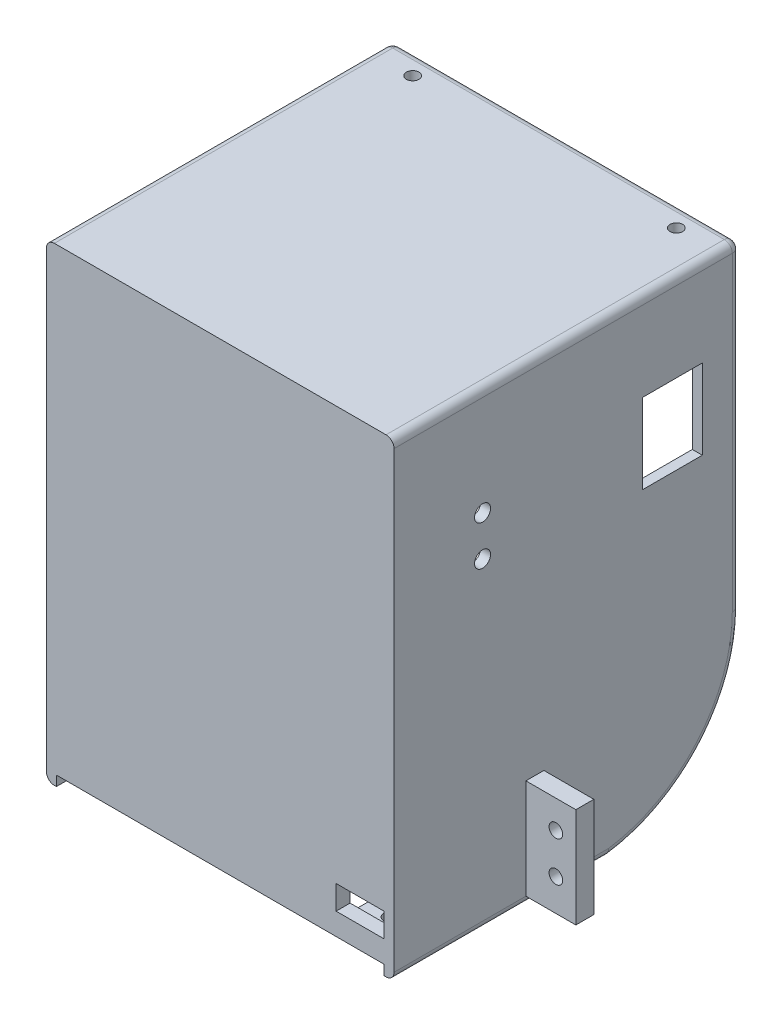
from build123d import *
from build123d.topology import SkipClean

# Parameters (mm, degrees)
BOSS_EXTRUDE1_DEPTH     = 50
SKETCH3_W               = 92
SKETCH3_H               = 120
BOSS_EXTRUDE2_DEPTH     = 5
SKETCH4_W               = 8.115199035
SKETCH4_H               = 120
BOSS_EXTRUDE3_DEPTH     = 12
BOSS_EXTRUDE4_DEPTH     = 60
SKETCH5_W               = 10
SKETCH5_H               = 2
BOSS_EXTRUDE5_DEPTH     = 20
BOSS_EXTRUDE6_START     = 50
SKETCH5_2_W             = 10
SKETCH5_2_H             = 2
BOSS_EXTRUDE6_DEPTH     = 20
SKETCH6_W               = 92
SKETCH6_H               = 120
BOSS_EXTRUDE7_DEPTH     = 5
SKETCH7_W               = 7
SKETCH7_H               = 10
SKETCH7_R               = 1.6
BOSS_EXTRUDE8_DEPTH     = 3
CUT_EXTRUDE2_DEPTH      = 164.816971038
CUT_EXTRUDE4_DEPTH      = 165.373051319
CUT_EXTRUDE4_DEPTH_BACK = 165.373051319
SKETCH12_W              = 112.5
SKETCH12_H              = 2.5
SKETCH14_W              = 106
SKETCH14_H              = 1.5
CUT_EXTRUDE5_DEPTH      = 162.085381087
SKETCH15_R              = 1.6
BOSS_EXTRUDE10_DEPTH    = 2
SKETCH16_W              = 87
SKETCH16_H              = 3.364665628
CUT_EXTRUDE6_DEPTH      = 162.085381087
SKETCH17_W              = 10
SKETCH17_H              = 2
CUT_EXTRUDE7_DEPTH      = 70
SKETCH19_W              = 7
SKETCH19_H              = 10
SKETCH19_R              = 1.6
BOSS_EXTRUDE11_DEPTH    = 3.5
SKETCH21_W              = 7
SKETCH21_H              = 10
SKETCH21_R              = 1.6
BOSS_EXTRUDE13_DEPTH    = 3.5
SKETCH22_W              = 9.5
SKETCH22_H              = 117.5
CUT_EXTRUDE8_DEPTH      = 186.007067988
CUT_EXTRUDE9_DEPTH      = 156.903445849
SKETCH26_W              = 12
SKETCH26_H              = 12
CUT_EXTRUDE10_DEPTH     = 8.115199035
SKETCH27_R              = 1.575
CUT_EXTRUDE11_DEPTH     = 6
SKETCH28_W              = 82
SKETCH28_H              = 11.615199035
CUT_EXTRUDE12_DEPTH     = 2.5
SKETCH30_R              = 1.575
CUT_EXTRUDE13_DEPTH     = 2.5
SKETCH31_W              = 12
SKETCH31_H              = 6
CUT_EXTRUDE14_DEPTH     = 3.5
FILLET1_R               = 2
FILLET2_R               = 2
SKETCH32_W              = 15
SKETCH32_H              = 20
CUT_EXTRUDE15_DEPTH     = 2.5
SKETCH33_R              = 2
CUT_EXTRUDE16_DEPTH     = 2.5
SKETCH37_W              = 4.5
SKETCH37_H              = 25
BOSS_EXTRUDE17_DEPTH    = 12.5
BOSS_EXTRUDE18_START    = -87
SKETCH37_2_W            = 4.5
SKETCH37_2_H            = 25
BOSS_EXTRUDE18_DEPTH    = 12.5
SKETCH39_R              = 1.7
CUT_EXTRUDE17_DEPTH     = 4.5
SKETCH40_R              = 1.7
CUT_EXTRUDE18_DEPTH     = 4.5


with BuildPart() as part:
    # Sketch2 → Boss-Extrude1 (new body)
    with BuildSketch(Plane.XY):
        Polygon((0, 0), (0, 115), (82, 115), (82, 0), (87, 0), (87, 120), (-5, 120), (-5, 0), align=None)
    extrude(amount=BOSS_EXTRUDE1_DEPTH)

    # Sketch3 → Boss-Extrude2 (add)
    with BuildSketch(Plane.XY.offset(50)):
        with Locations((41, 60)):
            Rectangle(SKETCH3_W, SKETCH3_H)
    extrude(amount=BOSS_EXTRUDE2_DEPTH)

    # Sketch4 → Boss-Extrude3 (add)
    with BuildSketch(Plane.ZY.offset(-82)):
        with Locations((45.942400483, 60)):
            Rectangle(SKETCH4_W, SKETCH4_H)
    extrude(amount=BOSS_EXTRUDE3_DEPTH)

    # Sketch2<2> → Boss-Extrude4 (add)
    with BuildSketch(Plane.XY):
        Polygon((0, 0), (0, 115), (82, 115), (82, 0), (87, 0), (87, 120), (-5, 120), (-5, 0), align=None)
    extrude(amount=-BOSS_EXTRUDE4_DEPTH)

    # Sketch5 → Boss-Extrude5 (add)
    with BuildSketch(Plane.XZ.offset(-115)):
        with Locations((5, 7.889828052)):
            Rectangle(SKETCH5_W, SKETCH5_H)
        with Locations((5, 2.689828052)):
            Rectangle(SKETCH5_W, SKETCH5_H)
        with Locations((77, 2.689828052)):
            Rectangle(SKETCH5_W, SKETCH5_H)
        with Locations((77, 7.889828052)):
            Rectangle(SKETCH5_W, SKETCH5_H)
    extrude(amount=BOSS_EXTRUDE5_DEPTH)

    # Sketch5<2> → Boss-Extrude6 (add)
    with BuildSketch(Plane.XZ.offset(-115).offset(BOSS_EXTRUDE6_START)):
        with Locations((5, 7.889828052)):
            Rectangle(SKETCH5_2_W, SKETCH5_2_H)
        with Locations((5, 2.689828052)):
            Rectangle(SKETCH5_2_W, SKETCH5_2_H)
        with Locations((77, 2.689828052)):
            Rectangle(SKETCH5_2_W, SKETCH5_2_H)
        with Locations((77, 7.889828052)):
            Rectangle(SKETCH5_2_W, SKETCH5_2_H)
    extrude(amount=BOSS_EXTRUDE6_DEPTH)

    # Sketch6 → Boss-Extrude7 (add)
    with BuildSketch(Plane(origin=(0, 0, -60), x_dir=(-1, 0, 0), z_dir=(0, 0, -1))):
        with Locations((-41, 60)):
            Rectangle(SKETCH6_W, SKETCH6_H)
    extrude(amount=-BOSS_EXTRUDE7_DEPTH)

    # Sketch7 → Boss-Extrude8 (add)
    # profile 1 of 4: a face of its own
    with BuildSketch(Plane.XY.offset(55)):
        with Locations((90.5, 115)):
            Rectangle(SKETCH7_W, SKETCH7_H)
        with Locations((90.472155735, 113.006992181)):
            Circle(SKETCH7_R, mode=Mode.SUBTRACT)
    # profile 2 of 4: a face of its own
    with BuildSketch(Plane.XY.offset(55)):
        with Locations((-8.5, 115)):
            Rectangle(SKETCH7_W, SKETCH7_H)
        with Locations(Location((-8.472155735, 113.006992181, 0), (0, 0, 180))):
            Circle(SKETCH7_R, mode=Mode.SUBTRACT)
    # profile 3 of 4: a face of its own
    with BuildSketch(Plane.XY.offset(55)):
        with Locations((-8.5, 5)):
            Rectangle(SKETCH7_W, SKETCH7_H)
        with Locations((-8.472155735, 6.993007819)):
            Circle(SKETCH7_R, mode=Mode.SUBTRACT)
    # profile 4 of 4: a face of its own
    with BuildSketch(Plane.XY.offset(55)):
        with Locations((90.5, 5)):
            Rectangle(SKETCH7_W, SKETCH7_H)
        with Locations(Location((90.472155735, 6.993007819, 0), (0, 0, 180))):
            Circle(SKETCH7_R, mode=Mode.SUBTRACT)
    extrude(amount=-BOSS_EXTRUDE8_DEPTH)

    # Sketch11 → Cut-Extrude2 (cut, through all)
    with BuildSketch(Plane.XZ):
        Polygon((-5, 52), (-2.5, 52), (-2.5, -57.5), (84.5, -57.5), (84.5, 52), (87, 52), (87, -60), (-5, -60), align=None)
    extrude(amount=-CUT_EXTRUDE2_DEPTH, mode=Mode.SUBTRACT)

    # Sketch12 → Cut-Extrude4 (cut, two sides: drawn at the far end of the back side and taken through both)
    with BuildSketch(Plane.ZY.offset(2.5).offset(-CUT_EXTRUDE4_DEPTH_BACK)):
        with Locations((-1.25, 118.75)):
            Rectangle(SKETCH12_W, SKETCH12_H)
    extrude(amount=CUT_EXTRUDE4_DEPTH + CUT_EXTRUDE4_DEPTH_BACK, mode=Mode.SUBTRACT)

    # Sketch14 → Cut-Extrude5 (cut, through all)
    with BuildSketch(Plane.XZ):
        with Locations((41, 54.25)):
            Rectangle(SKETCH14_W, SKETCH14_H)
    extrude(amount=-CUT_EXTRUDE5_DEPTH, mode=Mode.SUBTRACT)

    # Sketch15 → Boss-Extrude10 (add)
    # profile 1 of 2: a face of its own
    with SkipClean():  # the faces are left unmerged after this step: merging them gives an invalid solid
        with BuildSketch(Plane(origin=(0, 0, 52), x_dir=(-1, 0, 0), z_dir=(0, 0, -1))):
            Polygon((-84.5, 117.5), (-94, 117.5), (-94, 110), (-87, 110), (-87, 10), (-94, 10), (-94, 0), (-84.5, 0), align=None)
            with Locations((-90.472155735, 113.006992181)):
                Circle(SKETCH15_R, mode=Mode.SUBTRACT)
            with Locations((-90.472155735, 6.993007819)):
                Circle(SKETCH15_R, mode=Mode.SUBTRACT)
        # profile 2 of 2: a face of its own
        with BuildSketch(Plane(origin=(0, 0, 52), x_dir=(-1, 0, 0), z_dir=(0, 0, -1))):
            Polygon((2.5, 0), (2.5, 117.5), (12, 117.5), (12, 110), (5, 110), (5, 10), (12, 10), (12, 0), align=None)
            with Locations(Location((8.472155735, 113.006992181, 0), (0, 0, 180))):
                Circle(SKETCH15_R, mode=Mode.SUBTRACT)
            with Locations(Location((8.472155735, 6.993007819, 0), (0, 0, 180))):
                Circle(SKETCH15_R, mode=Mode.SUBTRACT)
        extrude(amount=BOSS_EXTRUDE10_DEPTH)

    # Sketch16 → Cut-Extrude6 (cut, through all)
    with SkipClean():  # the faces are left unmerged after this step: merging them gives an invalid solid
        with BuildSketch(Plane.XZ):
            with Locations((41, -55.817667186)):
                Rectangle(SKETCH16_W, SKETCH16_H)
        extrude(amount=-CUT_EXTRUDE6_DEPTH, mode=Mode.SUBTRACT)

    # Sketch17 → Cut-Extrude7 (cut)
    with SkipClean():  # the faces are left unmerged after this step: merging them gives an invalid solid
        with BuildSketch(Plane.XZ.offset(-45)):
            with Locations((5, 2.689828052)):
                Rectangle(SKETCH17_W, SKETCH17_H)
            with Locations((77, 2.689828052)):
                Rectangle(SKETCH17_W, SKETCH17_H)
        extrude(amount=-CUT_EXTRUDE7_DEPTH, mode=Mode.SUBTRACT)

    # Sketch19 → Boss-Extrude11 (add)
    # profile 1 of 4: a face of its own
    with SkipClean():  # the faces are left unmerged after this step: merging them gives an invalid solid
        with BuildSketch(Plane.XZ):
            with Locations((88, -49.135334372)):
                Rectangle(SKETCH19_W, SKETCH19_H)
            with Locations((87.901562489, -49.234834013)):
                Circle(SKETCH19_R, mode=Mode.SUBTRACT)
        # profile 2 of 4: a face of its own
        with BuildSketch(Plane.XZ):
            with Locations((-6, -49.135334372)):
                Rectangle(SKETCH19_W, SKETCH19_H)
            with Locations(Location((-5.901562489, -49.234834013, 0), (0, 0, 180))):
                Circle(SKETCH19_R, mode=Mode.SUBTRACT)
        # profile 3 of 4: a face of its own
        with BuildSketch(Plane.XZ):
            with Locations((-6, 34.080676656)):
                Rectangle(SKETCH19_W, SKETCH19_H)
            with Locations((-5.901562489, 34.180176298)):
                Circle(SKETCH19_R, mode=Mode.SUBTRACT)
        # profile 4 of 4: a face of its own
        with BuildSketch(Plane.XZ):
            with Locations((88, 34.080676656)):
                Rectangle(SKETCH19_W, SKETCH19_H)
            with Locations(Location((87.901562489, 34.180176298, 0), (0, 0, 180))):
                Circle(SKETCH19_R, mode=Mode.SUBTRACT)
        extrude(amount=-BOSS_EXTRUDE11_DEPTH)

    # Sketch21 → Boss-Extrude13 (add)
    # profile 1 of 4: a face of its own
    with SkipClean():  # the faces are left unmerged after this step: merging them gives an invalid solid
        with BuildSketch(Plane(origin=(0, 0, -54.135334372), x_dir=(-1, 0, 0), z_dir=(0, 0, -1))):
            with Locations((-88, 112.5)):
                Rectangle(SKETCH21_W, SKETCH21_H)
            with Locations((-87.460864154, 112.996655596)):
                Circle(SKETCH21_R, mode=Mode.SUBTRACT)
        # profile 2 of 4: a face of its own
        with BuildSketch(Plane(origin=(0, 0, -54.135334372), x_dir=(-1, 0, 0), z_dir=(0, 0, -1))):
            with Locations((6, 112.5)):
                Rectangle(SKETCH21_W, SKETCH21_H)
            with Locations(Location((5.460864154, 112.996655596, 0), (0, 0, 180))):
                Circle(SKETCH21_R, mode=Mode.SUBTRACT)
        # profile 3 of 4: a face of its own
        with BuildSketch(Plane(origin=(0, 0, -54.135334372), x_dir=(-1, 0, 0), z_dir=(0, 0, -1))):
            with Locations((6, 17.859776919)):
                Rectangle(SKETCH21_W, SKETCH21_H)
            with Locations((5.460864154, 17.363121322)):
                Circle(SKETCH21_R, mode=Mode.SUBTRACT)
        # profile 4 of 4: a face of its own
        with BuildSketch(Plane(origin=(0, 0, -54.135334372), x_dir=(-1, 0, 0), z_dir=(0, 0, -1))):
            with Locations((-88, 17.859776919)):
                Rectangle(SKETCH21_W, SKETCH21_H)
            with Locations(Location((-87.460864154, 17.363121322, 0), (0, 0, 180))):
                Circle(SKETCH21_R, mode=Mode.SUBTRACT)
        extrude(amount=-BOSS_EXTRUDE13_DEPTH)

    # Sketch22 → Cut-Extrude8 (cut, through all)
    with BuildSketch(Plane(origin=(0, 0, -54.135334372), x_dir=(-1, 0, 0), z_dir=(0, 0, -1))):
        with Locations((7.25, 58.75)):
            Rectangle(SKETCH22_W, SKETCH22_H)
        with Locations((-89.25, 58.75)):
            Rectangle(SKETCH22_W, SKETCH22_H)
    extrude(amount=-CUT_EXTRUDE8_DEPTH, mode=Mode.SUBTRACT)

    # Sketch24 → Cut-Extrude9 (cut, through all)
    with BuildSketch(Plane.ZY.offset(2.5)):
        with BuildLine():
            Line((-33.153862192, 117.5), (-33.153862192, 37.737088179))
            ThreePointArc((-33.153862192, 37.737088179), (-23.795591024, 12.725573197), (-0.317667186, 0))
            Line((-0.317667186, 0), (-54.135334372, 0))
            Line((-54.135334372, 0), (-54.135334372, 117.5))
            Line((-54.135334372, 117.5), (-33.153862192, 117.5))
        make_face()
    extrude(amount=-CUT_EXTRUDE9_DEPTH, mode=Mode.SUBTRACT)

    # Sketch26 → Cut-Extrude10 (cut)
    with BuildSketch(Plane(origin=(0, 0, 41.884800965), x_dir=(-1, 0, 0), z_dir=(0, 0, -1))):
        with Locations((-76, 12)):
            Rectangle(SKETCH26_W, SKETCH26_H)
    extrude(amount=-CUT_EXTRUDE10_DEPTH, mode=Mode.SUBTRACT)

    # Sketch27 → Cut-Extrude11 (cut)
    with BuildSketch(Plane.XZ):
        with Locations((76, 46.036602525)):
            Circle(SKETCH27_R)
    extrude(amount=-CUT_EXTRUDE11_DEPTH, mode=Mode.SUBTRACT)

    # Sketch28 → Cut-Extrude12 (cut)
    with BuildSketch(Plane.XZ):
        with Locations((41, 47.692400483)):
            Rectangle(SKETCH28_W, SKETCH28_H)
    extrude(amount=-CUT_EXTRUDE12_DEPTH, mode=Mode.SUBTRACT)

    # Sketch30 → Cut-Extrude13 (cut)
    with BuildSketch(Plane(origin=(0, 117.5, 0), x_dir=(1, 0, 0), z_dir=(0, 1, 0))):
        with Locations(Location((74, 27.653862192, 0), (0, 0, 180))):
            Circle(SKETCH30_R)
        with Locations(Location((8, 27.653862192, 0), (0, 0, 270))):
            Circle(SKETCH30_R)
    extrude(amount=-CUT_EXTRUDE13_DEPTH, mode=Mode.SUBTRACT)

    # Sketch31 → Cut-Extrude14 (cut)
    with BuildSketch(Plane(origin=(0, 0, 50), x_dir=(-1, 0, 0), z_dir=(0, 0, -1))):
        with Locations((-76, 11)):
            Rectangle(SKETCH31_W, SKETCH31_H)
    extrude(amount=-CUT_EXTRUDE14_DEPTH, mode=Mode.SUBTRACT)

    # Fillet1
    fillet1_edges = [part.edges().sort_by_distance(p)[0] for p in [
        (-2.5, 117.5, 10.173068904),
    ]]
    fillet(fillet1_edges, radius=FILLET1_R)

    # Fillet2
    # the kernel refuses this fillet: 2 mm, written as the material it takes off along each edge
    with BuildSketch(Plane(origin=(82.5, 115.5, -31.153862192), x_dir=(1, 0, 0), z_dir=(0, 1, 0))) as fillet2_piece_1_section:
        Polygon((0, 0), (FILLET2_R, 0), (FILLET2_R, FILLET2_R), (0, FILLET2_R), align=None)
    fillet2_piece_1 = extrude(amount=FILLET2_R, mode=Mode.PRIVATE)
    fillet2_piece_1 = fillet2_piece_1 - Plane(origin=(82.5, 115.5, -31.153862192), x_dir=(-0.7071067811865477, 0, 0.7071067811865475), z_dir=(0, 1, 0)) * Sphere(FILLET2_R, mode=Mode.PRIVATE)
    add(fillet2_piece_1, mode=Mode.SUBTRACT)
    with BuildSketch(Plane(origin=(-0.5, 115.5, -33.153862192), x_dir=(-1, 0, 0), z_dir=(0, -1, 0))) as fillet2_piece_2:
        with BuildLine():
            CenterArc((2 - FILLET2_R, -FILLET2_R), FILLET2_R, 0, 90)
            Line((2 - FILLET2_R, 0), (2, 0))
            Line((2, 0), (2, -FILLET2_R))
        make_face()
    revolve(axis=Axis((-0.5, 115.5, -33.153862192), (0, 0, -1)), revolution_arc=90, mode=Mode.SUBTRACT)
    with BuildSketch(Plane(origin=(84.5, 0, -5.317667186), x_dir=(0, 1, 0), z_dir=(0, 0, 1)), Plane(origin=(-2.5, 0, 58.5), x_dir=(0, 1, 0), z_dir=(0, 0, -1))) as fillet2_piece_3:
        with BuildLine():
            CenterArc((FILLET2_R, FILLET2_R), FILLET2_R, 180, 90)
            Line((0, FILLET2_R), (0, 0))
            Line((0, 0), (FILLET2_R, 0))
        make_face()
    extrude(amount=63.817667186, mode=Mode.SUBTRACT)
    with BuildSketch(Plane(origin=(84.5, 117.5, -31.153862192), x_dir=(-1, 0, 0), z_dir=(0, 0, 1))) as fillet2_piece_4:
        with BuildLine():
            CenterArc((FILLET2_R, FILLET2_R), FILLET2_R, 180, 90)
            Line((0, FILLET2_R), (0, 0))
            Line((0, 0), (FILLET2_R, 0))
        make_face()
    extrude(amount=89.653862192, mode=Mode.SUBTRACT)
    with BuildSketch(Plane(origin=(84.5, 37.737088179, 4.948961936), x_dir=(0, 0, -1), z_dir=(0, 1, 0))) as fillet2_piece_5:
        with BuildLine():
            CenterArc((38.102824128 - FILLET2_R, FILLET2_R), FILLET2_R, 270, 90)
            Line((38.102824128, FILLET2_R), (38.102824128, 0))
            Line((38.102824128, 0), (38.102824128 - FILLET2_R, 0))
        make_face()
    revolve(axis=Axis((84.5, 37.737088179, 4.948961936), (-1, 0, 0)), revolution_arc=89.576139728, mode=Mode.SUBTRACT)
    with BuildSketch(Plane(origin=(84.5, 37.737088179, -33.153862192), x_dir=(0, 0, 1), z_dir=(0, 1, 0)), Plane(origin=(-2.5, 115.5, -33.153862192), x_dir=(0, 0, 1), z_dir=(0, -1, 0))) as fillet2_piece_6:
        with BuildLine():
            CenterArc((FILLET2_R, -FILLET2_R), FILLET2_R, 90, 90)
            Line((0, -FILLET2_R), (0, 0))
            Line((0, 0), (FILLET2_R, 0))
        make_face()
    extrude(amount=77.762911821, mode=Mode.SUBTRACT)
    with BuildSketch(Plane(origin=(-0.5, 117.5, -33.153862192), x_dir=(0, 0, 1), z_dir=(1, 0, 0))) as fillet2_piece_7:
        with BuildLine():
            CenterArc((FILLET2_R, FILLET2_R), FILLET2_R, 180, 90)
            Line((0, FILLET2_R), (0, 0))
            Line((0, 0), (FILLET2_R, 0))
        make_face()
    extrude(amount=83, mode=Mode.SUBTRACT)
    with BuildSketch(Plane(origin=(-2.5, 37.737088179, 4.948961936), x_dir=(0, 0, -1), z_dir=(0, 1, 0))) as fillet2_piece_8:
        with BuildLine():
            CenterArc((38.102824128 - FILLET2_R, -FILLET2_R), FILLET2_R, 0, 90)
            Line((38.102824128, -FILLET2_R), (38.102824128, 0))
            Line((38.102824128, 0), (38.102824128 - FILLET2_R, 0))
        make_face()
    revolve(axis=Axis((-2.5, 37.737088179, 4.948961936), (-1, 0, 0)), revolution_arc=89.576139728, mode=Mode.SUBTRACT)

    # Sketch32 → Cut-Extrude15 (cut)
    with BuildSketch(Plane(origin=(84.5, 0, 0), x_dir=(0, 0, -1), z_dir=(1, 0, 0))):
        with Locations((16.153862192, 85.5)):
            Rectangle(SKETCH32_W, SKETCH32_H)
    extrude(amount=-CUT_EXTRUDE15_DEPTH, mode=Mode.SUBTRACT)

    # Sketch33 → Cut-Extrude16 (cut)
    with BuildSketch(Plane(origin=(84.5, 0, 0), x_dir=(0, 0, -1), z_dir=(1, 0, 0))):
        with Locations(Location((-31.346137808, 90.5, 0), (0, 0, 90))):
            Circle(SKETCH33_R)
        with Locations(Location((-31.346137808, 80.5, 0), (0, 0, 90))):
            Circle(SKETCH33_R)
    extrude(amount=-CUT_EXTRUDE16_DEPTH, mode=Mode.SUBTRACT)

    # Sketch37 → Boss-Extrude17 (add)
    with BuildSketch(Plane.ZY.offset(2.5)):
        with Locations((18.25, 14.5)):
            Rectangle(SKETCH37_W, SKETCH37_H)
    extrude(amount=BOSS_EXTRUDE17_DEPTH)

    # Sketch37<2> → Boss-Extrude18 (add)
    with BuildSketch(Plane.ZY.offset(2.5).offset(BOSS_EXTRUDE18_START)):
        with Locations((18.25, 14.5)):
            Rectangle(SKETCH37_2_W, SKETCH37_2_H)
    extrude(amount=-BOSS_EXTRUDE18_DEPTH)

    # Sketch39 → Cut-Extrude17 (cut)
    with BuildSketch(Plane(origin=(0, 0, 16), x_dir=(-1, 0, 0), z_dir=(0, 0, -1))):
        with Locations((10, 10)):
            Circle(SKETCH39_R)
        with Locations((10, 20)):
            Circle(SKETCH39_R)
    extrude(amount=-CUT_EXTRUDE17_DEPTH, mode=Mode.SUBTRACT)

    # Sketch40 → Cut-Extrude18 (cut)
    with BuildSketch(Plane(origin=(0, 0, 16), x_dir=(-1, 0, 0), z_dir=(0, 0, -1))):
        with Locations((-92, 10)):
            Circle(SKETCH40_R)
        with Locations((-92, 20)):
            Circle(SKETCH40_R)
    extrude(amount=-CUT_EXTRUDE18_DEPTH, mode=Mode.SUBTRACT)


solid = part.part
